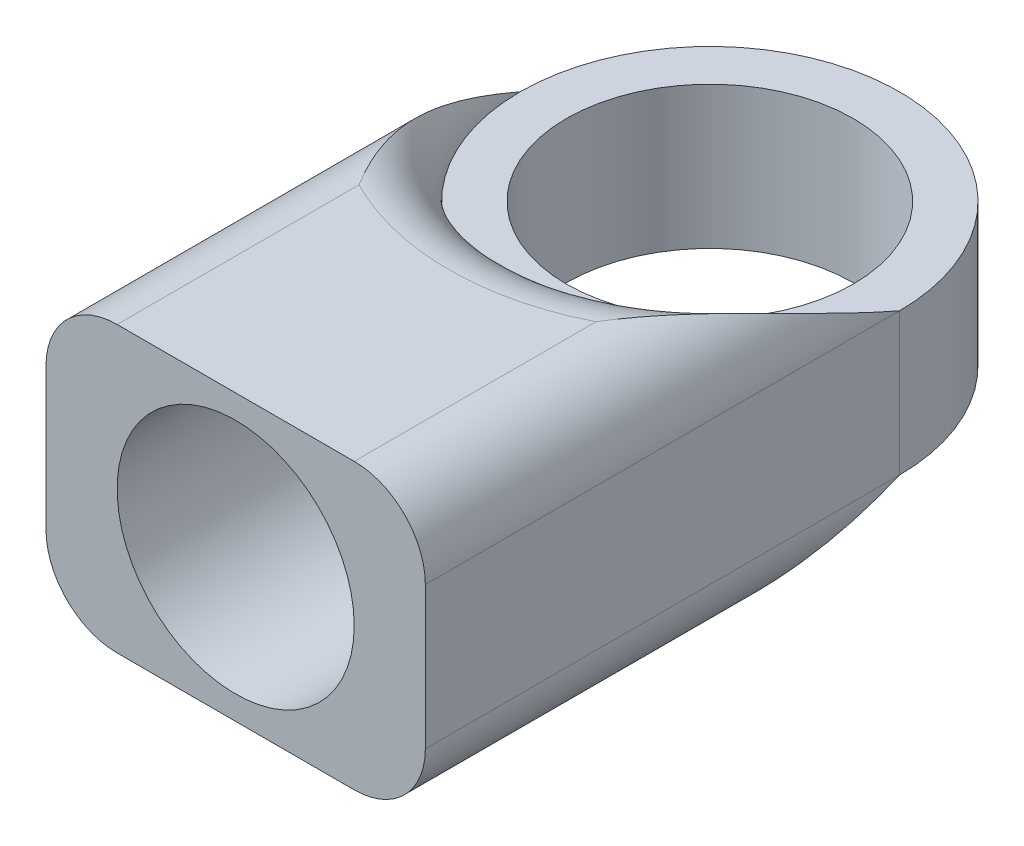
from build123d import *
from OCP.BRepAlgoAPI import BRepAlgoAPI_Cut
from OCP.TopTools import TopTools_ListOfShape

# Parameters (mm, degrees)
BOSS_EXTRUDE2_DEPTH = 6
SKETCH3_4_R         = 8.000000000000005
SKETCH3_4_R_2       = 6.050000000000002
BOSS_EXTRUDE3_DEPTH = 3
FILLET3_R           = 3
SKETCH7_R           = 5
CUT_EXTRUDE2_DEPTH  = 10
FILLET4_START       = -11
FILLET4_DEPTH       = 22


with BuildPart() as part:
    # Sketch3 → Boss-Extrude2 (new, symmetric)
    with BuildSketch(Plane(origin=(0, 0, 0), x_dir=(1, 0, 0), z_dir=(0, 1, 0))):
        with BuildLine():
            Line((8, -10), (8, 10))
            ThreePointArc((8.000000000000002, 10), (-4.43e-15, 1.9999999999999964), (-8.000000000000009, 10.000000000000004))
            Line((-8, 10), (-8, -10))
            Line((-8, -10), (8, -10))
        make_face()
    extrude(amount=BOSS_EXTRUDE2_DEPTH, both=True)

    # Sketch3<4> → Boss-Extrude3 (add, symmetric)
    with BuildSketch(Plane(origin=(0, 0, 0), x_dir=(1, 0, 0), z_dir=(0, 1, 0))):
        with Locations((-2.96e-15, 10.000000000000002)):
            Circle(SKETCH3_4_R)
        with Locations(Location((-2.96e-15, 10.000000000000002, 0), (0, 0, 270))):
            Circle(SKETCH3_4_R_2, mode=Mode.SUBTRACT)
    extrude(amount=BOSS_EXTRUDE3_DEPTH, both=True)

    # Fillet3
    fillet3_edges = [part.edges().sort_by_distance(p)[0] for p in [
        (-5.06e-15, -6, -1.9999999999999947),
        (-5.06e-15, 6, -1.9999999999999947),
    ]]
    fillet(fillet3_edges, radius=FILLET3_R - 0.0001)  # a hair under: the kernel refuses the full size

    # Sketch7 → Cut-Extrude2 (cut)
    with BuildSketch(Plane.XY.offset(10)):
        Circle(SKETCH7_R)
    extrude(amount=-CUT_EXTRUDE2_DEPTH, mode=Mode.SUBTRACT)


with BuildPart() as fillet4_tool:
    # Fillet4: read off the stored shape, not the designer's step
    # Fillet4 outline → Fillet4 (new body)
    with BuildSketch(Plane.XY.offset(FILLET4_START)):
        with BuildLine():
            Line((-8, 6), (-8, 3))
            ThreePointArc((-8, 3), (-7.121320344, 5.121320344), (-5, 6))
            Line((-5, 6), (-8, 6))
        make_face()
        with BuildLine():
            ThreePointArc((-5, -6), (-7.121320344, -5.121320344), (-8, -3))
            Line((-8, -3), (-8, -6))
            Line((-8, -6), (-5, -6))
        make_face()
        with BuildLine():
            Line((8, 6), (5, 6))
            ThreePointArc((5, 6), (7.121320344, 5.121320344), (8, 3))
            Line((8, 3), (8, 6))
        make_face()
        with BuildLine():
            ThreePointArc((8, -3), (7.121320344, -5.121320344), (5, -6))
            Line((5, -6), (8, -6))
            Line((8, -6), (8, -3))
        make_face()
    extrude(amount=FILLET4_DEPTH)


with BuildPart() as part_1:
    add(part.part)

    # Fillet4: cut by fillet4_tool, with a tolerance
    fillet4_stock = TopTools_ListOfShape()
    fillet4_stock.Append(part_1.part.wrapped)
    fillet4_tools = TopTools_ListOfShape()
    fillet4_tools.Append(fillet4_tool.part.wrapped)
    fillet4_cut = BRepAlgoAPI_Cut()
    fillet4_cut.SetArguments(fillet4_stock)
    fillet4_cut.SetTools(fillet4_tools)
    fillet4_cut.SetFuzzyValue(0.00001)
    fillet4_cut.Build()
    add(Compound.cast(fillet4_cut.Shape()).solids(), mode=Mode.REPLACE)


solid = part_1.part
